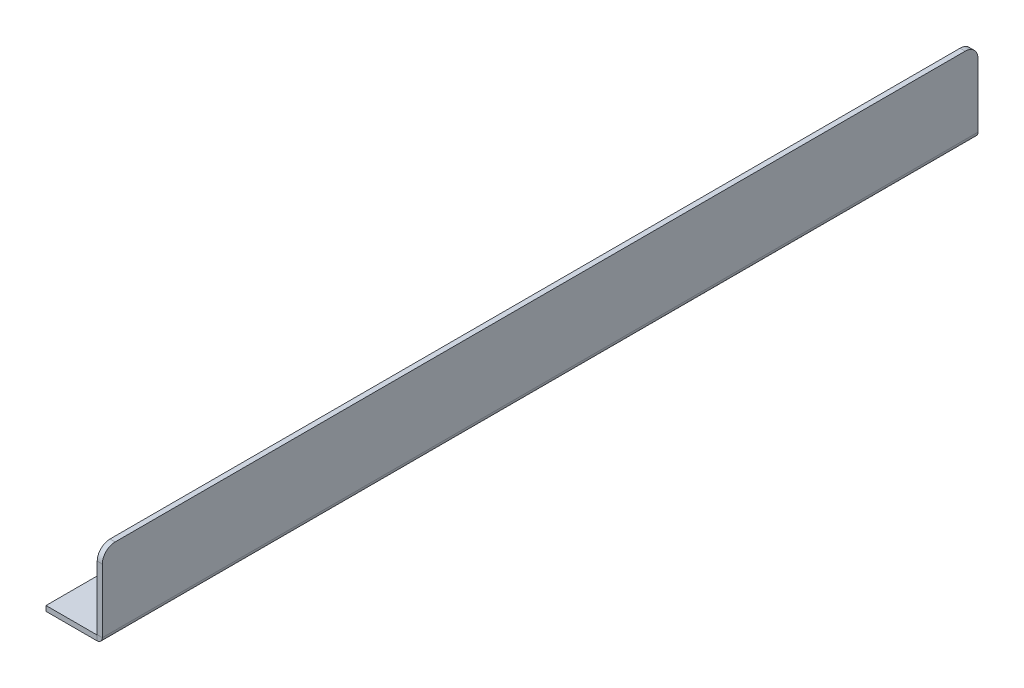
from build123d import *

# Parameters (mm, degrees)
BASIS_BLECH1_DEPTH                          = 342
VERRUNDUNG1_R                               = 5
FORMSENKUNG_F_R_M5_SENKSCHRAUBE_MIT_2_COUNT = 2
FORMSENKUNG_F_R_M5_SENKSCHRAUBE_MIT_2_PITCH = 207


# Sheet-metal steps are written as plain solids
with BuildPart() as part:
    # Skizze1 → Basis-Blech1 (new body)
    with BuildSketch(Plane.XY):
        with BuildLine():
            Line((0, 30), (0, 0.1))
            ThreePointArc((0, 0.1), (-0.029289322, 0.029289322), (-0.1, 0))
            Line((-0.1, 0), (-20, 0))
            Line((-20, 0), (-20, -2))
            Line((-20, -2), (-0.1, -2))
            ThreePointArc((-0.1, -2), (1.38492424, -1.38492424), (2, 0.1))
            Line((2, 0.1), (2, 30))
            Line((2, 30), (0, 30))
        make_face()
    extrude(amount=BASIS_BLECH1_DEPTH)

    # Verrundung1
    verrundung1_edges = [part.edges().sort_by_distance(p)[0] for p in [
        (1, 30, 342),
        (1, 30, 0),
    ]]
    fillet(verrundung1_edges, radius=VERRUNDUNG1_R)

    # Skizze2 → Formsenkung für M5 Senkschraube mit Innensechskant1 (revolve, cut)
    with BuildSketch(Plane(origin=(-11, 0, 55), x_dir=(0, 0, 1), z_dir=(1, 0, 0))):
        Polygon((0, 0), (0, 2), (2.75, 2), (2.75, 2.985), (5.735, 0), align=None)
    formsenkung_f_r_m5_senkschraube_mit_inne = revolve(axis=Axis((-11, 6.35, 55), (0, -1, 0)), mode=Mode.SUBTRACT)

    # Formsenkung f_r M5 Senkschraube mit  2: Formsenkung für M5 Senkschraube mit Innensechskant1 ×2
    with Locations(*[(0, 0, i * FORMSENKUNG_F_R_M5_SENKSCHRAUBE_MIT_2_PITCH) for i in range(1, FORMSENKUNG_F_R_M5_SENKSCHRAUBE_MIT_2_COUNT)]):
        add(formsenkung_f_r_m5_senkschraube_mit_inne, mode=Mode.SUBTRACT)


solid = part.part
